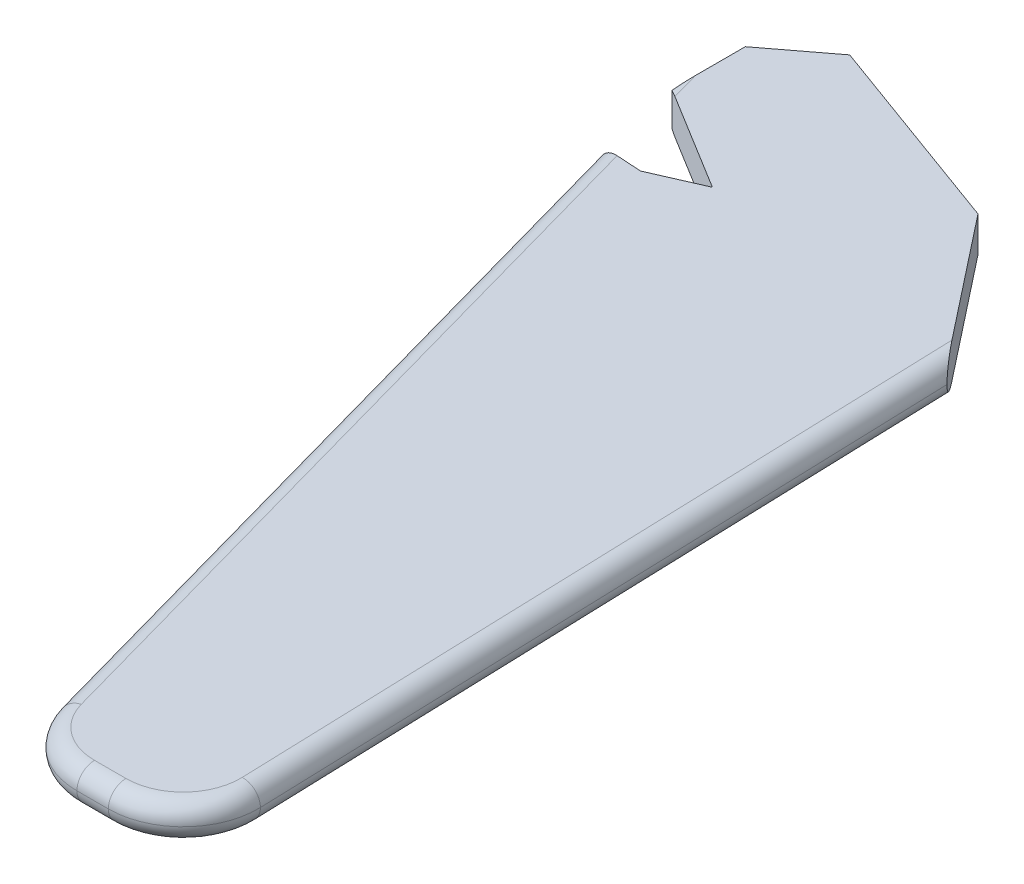
from build123d import *

# Parameters (mm, degrees)
BOSS_EXTRUDE1_DEPTH = 4
FILLET5_R           = 2
SKETCH3_R           = 4
BOSS_EXTRUDE2_DEPTH = 4
CUT_EXTRUDE1_START  = -8
CUT_EXTRUDE1_DEPTH  = 8
CUT_EXTRUDE2_REACH  = 74.805


with BuildPart() as part:
    # Sketch2 → Boss-Extrude1 (new body)
    with BuildSketch(Plane(origin=(0, 0, 0), x_dir=(1, 0, 0), z_dir=(0, 1, 0))):
        with BuildLine():
            Line((-19.444698737, 54.4597806), (-19.444698737, 28.4597806))
            Line((-19.444698737, 28.4597806), (5.602062826, -61.368686618))
            ThreePointArc((5.602062826, -61.368686618), (8.649467973, -65.855333302), (13.789742047, -67.585726043))
            Line((13.789742047, -67.585726043), (17.359306877, -67.585726043))
            ThreePointArc((17.359306877, -67.585726043), (23.466476793, -64.997787917), (25.854828389, -58.809837951))
            Line((25.854828389, -58.809837951), (22.177110502, 54.439455621))
            Line((22.177110502, 54.439455621), (22.802984938, 54.4597806))
            Line((22.802984938, 54.4597806), (-19.444698737, 54.4597806))
        make_face()
    extrude(amount=BOSS_EXTRUDE1_DEPTH)

    # Fillet5
    fillet5_edges = [part.edges().sort_by_distance(p)[0] for p in [
        (24.015969445, 4, 2.185191165),
        (23.466476793, 4, 64.997787917),
        (15.574524462, 4, 67.585726043),
        (8.649467973, 4, 65.855333302),
        (24.015969445, 0, 2.185191165),
        (23.466476793, 0, 64.997787917),
        (15.574524462, 0, 67.585726043),
        (8.649467973, 0, 65.855333302),
        (-19.444698737, 2, -28.4597806),
        (-6.921317955, 4, 16.454453009),
        (-6.921317955, 0, 16.454453009),
    ]]
    fillet(fillet5_edges, radius=FILLET5_R - 0.0001)  # a hair under: the kernel refuses the full size

    # Sketch3 → Boss-Extrude2 (add)
    with BuildSketch(Plane.XZ):
        with Locations(Location((-9.881069751, -35.033682073, 0), (0, 0, 90))):
            Circle(SKETCH3_R)
    extrude(amount=BOSS_EXTRUDE2_DEPTH)

    # Sketch4 → Cut-Extrude1 (cut)
    with BuildSketch(Plane(origin=(0, 4, 0), x_dir=(1, 0, 0), z_dir=(0, 1, 0)).offset(CUT_EXTRUDE1_START)):
        Polygon((23.237390651, 21.78986649), (-2.479011749, 54.4597806), (-19.444698737, 41.566075464), (-32.323067486, 58.511582656), (23.237390651, 102.246472628), (62.340489493, 52.570205291), align=None)
    extrude(amount=CUT_EXTRUDE1_DEPTH, mode=Mode.SUBTRACT)

    # Sketch5 → Cut-Extrude2 (cut, up to next)
    with BuildSketch(Plane(origin=(0, 4, 0), x_dir=(1, 0, 0), z_dir=(0, 1, 0)), mode=Mode.PRIVATE) as cut_extrude2_sk1:
        Polygon((10.216290077, 38.331769621), (-12.707477704, 46.686277287), (-5.274739107, 62.107031808), align=None)
    cut_extrude2_tool1 = extrude(cut_extrude2_sk1.sketch, amount=-CUT_EXTRUDE2_REACH, mode=Mode.PRIVATE) & part.part
    # Sketch5 → Cut-Extrude2 (cut, up to next)
    with BuildSketch(Plane(origin=(0, 4, 0), x_dir=(1, 0, 0), z_dir=(0, 1, 0)), mode=Mode.PRIVATE) as cut_extrude2_sk2:
        Polygon((-19.444698737, 33.221694621), (-7.48638486, 25.86937143), (-13.167620162, 23.386461187), (-19.9430193, 23.807293431), align=None)
    cut_extrude2_tool2 = extrude(cut_extrude2_sk2.sketch, amount=-CUT_EXTRUDE2_REACH, mode=Mode.PRIVATE) & part.part
    add(cut_extrude2_tool1.solids().sort_by_distance((-2.588642, 4, -49.041693))[0], mode=Mode.SUBTRACT)
    add(cut_extrude2_tool2.solids().sort_by_distance((-15.327917, 4, -27.167771))[0], mode=Mode.SUBTRACT)


solid = part.part
